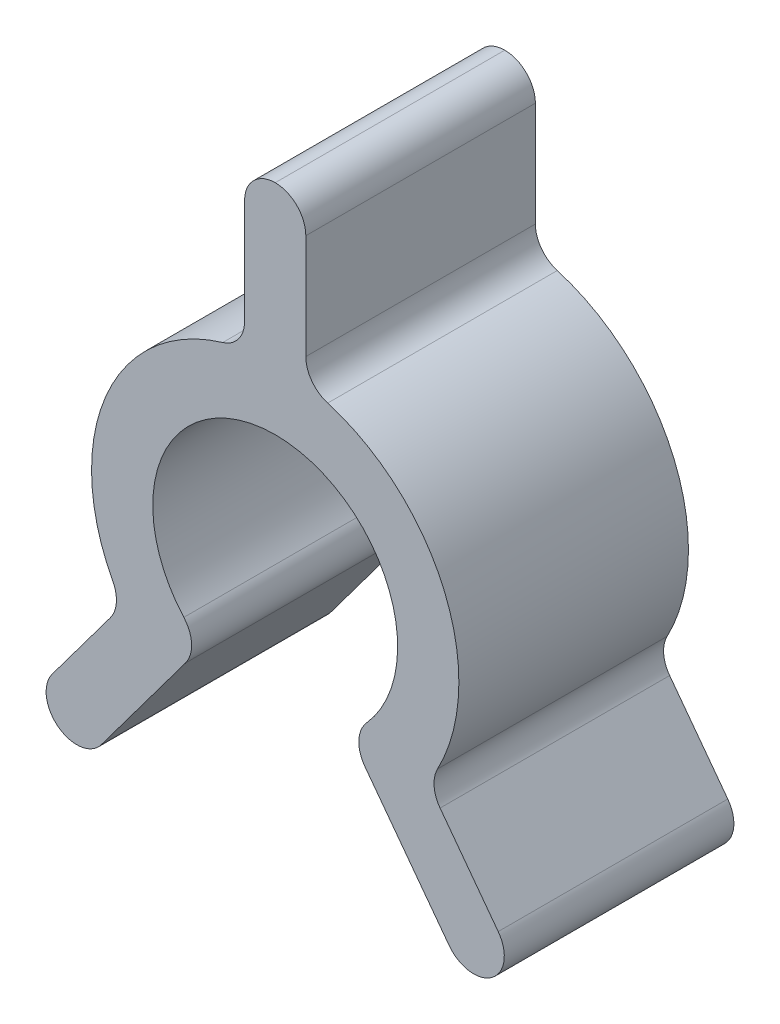
from build123d import *

# Parameters (mm, degrees)
BOSS_EXTRUDE1_DEPTH = 7.5
FILLET1_R           = 1
BOSS_EXTRUDE2_DEPTH = 2
FILLET2_R           = 0.2


with BuildPart() as part:
    # Sketch1 → Boss-Extrude1 (new body)
    with BuildSketch(Plane.XY):
        with BuildLine():
            Line((2.392596776, -3.20553906), (6.280566538, -8.414540033))
            Line((6.280566538, -8.414540033), (7.883336068, -7.218241645))
            Line((7.883336068, -7.218241645), (4.98641234, -3.337018425))
            ThreePointArc((4.98641234, -3.337018425), (5.510375649, 2.373975613), (1, 5.916079783))
            Line((1, 5.916079783), (1, 11.127644916))
            Line((1, 11.127644916), (-1, 11.127644916))
            Line((-1, 11.127644916), (-1, 5.916079783))
            ThreePointArc((-1, 5.916079783), (-5.510375649, 2.373975613), (-4.98641234, -3.337018425))
            Line((-4.98641234, -3.337018425), (-7.883336068, -7.218241645))
            Line((-7.883336068, -7.218241645), (-6.280566538, -8.414540033))
            Line((-6.280566538, -8.414540033), (-2.392596776, -3.20553906))
            ThreePointArc((-2.392596776, -3.20553906), (0, 4), (2.392596776, -3.20553906))
        make_face()
    extrude(amount=BOSS_EXTRUDE1_DEPTH)

    # Fillet1
    fillet1_edges = [part.edges().sort_by_distance(p)[0] for p in [
        (6.280566538, -8.414540033, 3.75),
        (7.883336068, -7.218241645, 3.75),
        (-6.280566538, -8.414540033, 3.75),
        (-7.883336068, -7.218241645, 3.75),
        (-4.98641234, -3.337018425, 3.75),
        (2.392596776, -3.20553906, 3.75),
        (-2.392596776, -3.20553906, 3.75),
        (4.98641234, -3.337018425, 3.75),
        (-1, 5.916079783, 3.75),
        (-1, 11.127644916, 3.75),
        (1, 11.127644916, 3.75),
        (1, 5.916079783, 3.75),
    ]]
    fillet(fillet1_edges, radius=FILLET1_R - 0.0001)  # a hair under: the kernel refuses the full size

    # Sketch2 → Boss-Extrude2 (add)
    with BuildSketch(Plane(origin=(0, 0, 0), x_dir=(-1, 0, 0), z_dir=(0, 0, -1))):
        with BuildLine():
            ThreePointArc((-0.2, 3.994996871), (-2.086004144, 3.413002594), (-3.464101615, 2))
            Line((-3.464101615, 2), (-0.2, 2))
            Line((-0.2, 2), (-0.2, 3.994996871))
        make_face()
        with BuildLine():
            Line((0.2, 3.994996871), (0.2, 2))
            Line((0.2, 2), (3.464101615, 2))
            ThreePointArc((3.464101615, 2), (2.086004144, 3.413002594), (0.2, 3.994996871))
        make_face()
    extrude(amount=-BOSS_EXTRUDE2_DEPTH)

    # Fillet2
    fillet2_edges = [part.edges().sort_by_distance(p)[0] for p in [
        (0.2, 3.994996871, 1),
        (-0.2, 3.994996871, 1),
        (-0.2, 2, 1),
        (0.2, 2, 1),
    ]]
    fillet(fillet2_edges, radius=FILLET2_R - 0.0001)  # a hair under: the kernel refuses the full size


solid = part.part
